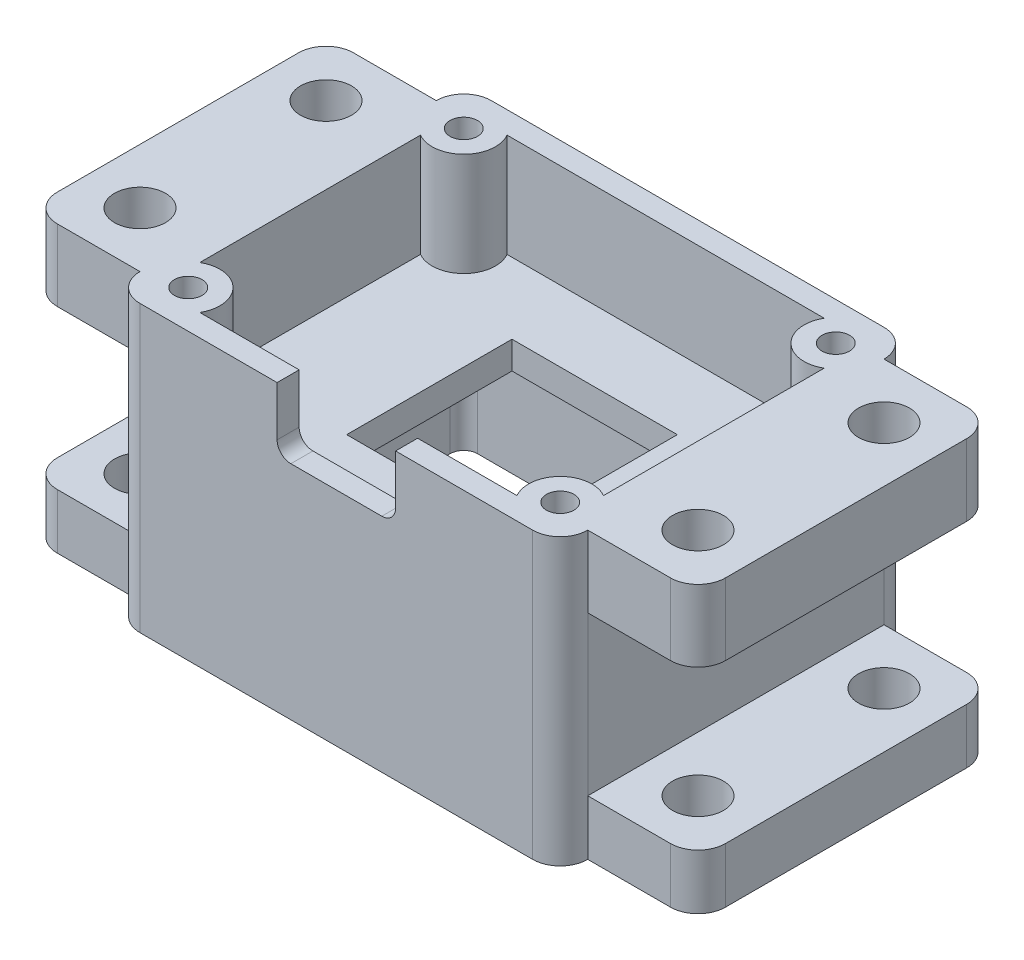
from build123d import *

# Parameters (mm, degrees)
SKETCH_1_W             = 32.5
SKETCH_1_H             = 25.5
SKETCH_1_W_2           = 28.5
SKETCH_1_H_2           = 21.5
EXTRUDE_1_DEPTH        = 13.2
SKETCH_2_W             = 28.5
SKETCH_2_H             = 21.5
SKETCH_2_W_2           = 12
SKETCH_2_H_2           = 12
EXTRUDE_2_DEPTH        = 2
EXTRUDE_3_DEPTH        = 6.3
EXTRUDE_4_REACH        = 30.406
SKETCH_6_R             = 2.7
SKETCH_7_R             = 1
CUT_EXTRUDE_3_DEPTH    = 5.5
SKETCH_10_W            = 15.8
SKETCH_10_H            = 15.8
SKETCH_10_W_2          = 14.2
SKETCH_10_H_2          = 14.2
EXTRUDE_5_DEPTH        = 0.8
CUT_EXTRUDE_5_DEPTH    = 3
FILLET_6_R             = 0.5
FILLET_1_R             = 2
FILLET_2_R             = 1
SKETCH_12_W            = 21.5
SKETCH_12_H            = 5
EXTRUDE_7_DEPTH        = 8
SKETCH_13_R            = 1.85
CUT_EXTRUDE_7_DEPTH    = 8
FILLET_7_R             = 2
SKETCH_15_W            = 21.5
SKETCH_15_H            = 5
EXTRUDE_8_DEPTH        = 8
CUT_EXTRUDE_START      = 26
SKETCH_13_3_R          = 1.85
CUT_EXTRUDE_8_DEPTH    = 26
FILLET_8_R             = 2
FILLET_7_OF_MIRROR_1_R = 2
FILLET_8_OF_MIRROR_1_R = 2
MOVE_START             = 13.2
MOVE_FACE_2_DEPTH      = 6.3
MOVE_FACE_3_BY         = 0.3
MOVE_FACE_3_2_BY       = 0.3
MOVE_FACE_3_3_BY       = 0.3
MOVE_FACE_3_4_BY       = 0.3
MOVE_FACE_3_5_BY       = 0.3
MOVE_FACE_3_6_BY       = 0.3
MOVE_FACE_3_7_BY       = 0.3
MOVE_FACE_3_8_BY       = 0.3
MOVE_FACE_3_9_BY       = 0.3
MOVE_FACE_3_10_BY      = 0.3
MOVE_FACE_3_11_BY      = 0.3
MOVE_FACE_3_12_BY      = 0.3
CUT_EXTRUDE_9_DEPTH    = 1
CUT_EXTRUDE_10_DEPTH   = 1
CUT_EXTRUDE_11_DEPTH   = 1
CUT_EXTRUDE_12_DEPTH   = 1
EXTRUDE_START          = 1.2
SKETCH_23_R            = 1.85
SKETCH_23_R_2          = 1
EXTRUDE_9_DEPTH        = 1.2
SKETCH_25_W            = 2
SKETCH_25_H            = 4.682452006
CUT_EXTRUDE_13_DEPTH   = 8.6
EXTRUDE_11_OUTLINE_W   = 8.6
EXTRUDE_11_OUTLINE_H   = 1.6
EXTRUDE_11_DEPTH       = 1.6
FILLET_9_R             = 1


# Read off the part's stored shape, not the designer's step: 移动面2, 凸台-拉伸11
with BuildPart() as part:
    # 草图1 → 凸台-拉伸1 (new body)
    with BuildSketch(Plane(origin=(0, 0, 0), x_dir=(1, 0, 0), z_dir=(0, 1, 0))):
        Rectangle(SKETCH_1_W, SKETCH_1_H)
        Rectangle(SKETCH_1_W_2, SKETCH_1_H_2, mode=Mode.SUBTRACT)
    extrude(amount=EXTRUDE_1_DEPTH)

    # 草图2 → 凸台-拉伸2 (add)
    with BuildSketch(Plane(origin=(0, 13.2, 0), x_dir=(1, 0, 0), z_dir=(0, 1, 0))):
        Rectangle(SKETCH_2_W, SKETCH_2_H)
        Rectangle(SKETCH_2_W_2, SKETCH_2_H_2, mode=Mode.SUBTRACT)
    extrude(amount=-EXTRUDE_2_DEPTH)

    # 草图3 → 凸台-拉伸3 (add)
    with BuildSketch(Plane(origin=(0, 13.2, 0), x_dir=(1, 0, 0), z_dir=(0, 1, 0))):
        Polygon((-16.25, -12.75), (-16.25, 12.75), (16.25, 12.75), (16.25, -0.040360215), (16.25, -12.75), align=None)
        Polygon((14.25, 0.013681835), (14.25, 10.75), (-14.25, 10.75), (-14.25, -10.75), (14.25, -10.75), align=None, mode=Mode.SUBTRACT)
    extrude(amount=EXTRUDE_3_DEPTH)

    # 草图6 → 凸台-拉伸4 (add, up to next)
    with BuildSketch(Plane(origin=(0, 19.5, 0), x_dir=(1, 0, 0), z_dir=(0, 1, 0)), mode=Mode.PRIVATE) as extrude_4_sk1:
        with Locations((13.5, 10)):
            Circle(SKETCH_6_R)
    extrude_4_tool1 = extrude(extrude_4_sk1.sketch, amount=-EXTRUDE_4_REACH, mode=Mode.PRIVATE) - part.part
    # 草图6 → 凸台-拉伸4 (add, up to next)
    with BuildSketch(Plane(origin=(0, 19.5, 0), x_dir=(1, 0, 0), z_dir=(0, 1, 0)), mode=Mode.PRIVATE) as extrude_4_sk2:
        with Locations((13.5, -10)):
            Circle(SKETCH_6_R)
    extrude_4_tool2 = extrude(extrude_4_sk2.sketch, amount=-EXTRUDE_4_REACH, mode=Mode.PRIVATE) - part.part
    # 草图6 → 凸台-拉伸4 (add, up to next)
    with BuildSketch(Plane(origin=(0, 19.5, 0), x_dir=(1, 0, 0), z_dir=(0, 1, 0)), mode=Mode.PRIVATE) as extrude_4_sk3:
        with Locations((-13.5, -10)):
            Circle(SKETCH_6_R)
    extrude_4_tool3 = extrude(extrude_4_sk3.sketch, amount=-EXTRUDE_4_REACH, mode=Mode.PRIVATE) - part.part
    # 草图6 → 凸台-拉伸4 (add, up to next)
    with BuildSketch(Plane(origin=(0, 19.5, 0), x_dir=(1, 0, 0), z_dir=(0, 1, 0)), mode=Mode.PRIVATE) as extrude_4_sk4:
        with Locations((-13.5, 10)):
            Circle(SKETCH_6_R)
    extrude_4_tool4 = extrude(extrude_4_sk4.sketch, amount=-EXTRUDE_4_REACH, mode=Mode.PRIVATE) - part.part
    add(extrude_4_tool1.solids().sort_by_distance((13.5, 19.5, -10))[0])
    add(extrude_4_tool2.solids().sort_by_distance((13.5, 19.5, 10))[0])
    add(extrude_4_tool3.solids().sort_by_distance((-13.5, 19.5, 10))[0])
    add(extrude_4_tool4.solids().sort_by_distance((-13.5, 19.5, -10))[0])

    # 草图7 → 切除-拉伸3 (cut)
    with BuildSketch(Plane(origin=(0, 19.5, 0), x_dir=(1, 0, 0), z_dir=(0, 1, 0))):
        with Locations(Location((13.5, 10, 0), (0, 0, 270))):
            Circle(SKETCH_7_R)
        with Locations(Location((13.5, -10, 0), (0, 0, 90))):
            Circle(SKETCH_7_R)
        with Locations(Location((-13.5, -10, 0), (0, 0, 270))):
            Circle(SKETCH_7_R)
        with Locations(Location((-13.5, 10, 0), (0, 0, 90))):
            Circle(SKETCH_7_R)
    extrude(amount=-CUT_EXTRUDE_3_DEPTH, mode=Mode.SUBTRACT)

    # 草图10 → 凸台-拉伸5 (add)
    with BuildSketch(Plane.XZ.offset(-11.2)):
        Rectangle(SKETCH_10_W, SKETCH_10_H)
        Rectangle(SKETCH_10_W_2, SKETCH_10_H_2, mode=Mode.SUBTRACT)
    extrude(amount=EXTRUDE_5_DEPTH)

    # 草图11 → 切除-拉伸5 (cut)
    with BuildSketch(Plane.XY.offset(12.75)):
        Polygon((-4, 17.65), (4, 17.65), (4, 15.8), (3, 14.8), (-3, 14.8), (-4, 15.8), align=None)
    extrude(amount=-CUT_EXTRUDE_5_DEPTH, mode=Mode.SUBTRACT)

    # 圆角6
    fillet_6_edges = [part.edges().sort_by_distance(p)[0] for p in [
        (4, 17.65, 11.75),
        (4, 15.8, 11.75),
        (3, 14.8, 11.75),
        (-3, 14.8, 11.75),
        (-4, 15.8, 11.75),
        (-4, 17.65, 11.75),
    ]]
    fillet(fillet_6_edges, radius=FILLET_6_R)

    # 圆角1
    fillet_1_edges = [part.edges().sort_by_distance(p)[0] for p in [
        (16.25, 9.75, 12.75),
        (-16.25, 9.75, 12.75),
        (-16.25, 9.75, -12.75),
        (16.25, 9.75, -12.75),
    ]]
    fillet(fillet_1_edges, radius=FILLET_1_R)

    # 圆角2
    fillet_2_edges = [part.edges().sort_by_distance(p)[0] for p in [
        (-14.25, 5.6, 10.75),
        (14.25, 5.6, 10.75),
        (-14.25, 5.6, -10.75),
        (14.25, 5.6, -10.75),
    ]]
    fillet(fillet_2_edges, radius=FILLET_2_R)

    # 草图12 → 凸台-拉伸7 (add)
    with BuildSketch(Plane(origin=(16.25, 0, 0), x_dir=(0, 0, -1), z_dir=(1, 0, 0))):
        with Locations((0, 2.5)):
            Rectangle(SKETCH_12_W, SKETCH_12_H)
    extrude_7 = extrude(amount=EXTRUDE_7_DEPTH)

    # 草图13 → 切除-拉伸7 (cut)
    with BuildSketch(Plane(origin=(0, 5, 0), x_dir=(1, 0, 0), z_dir=(0, 1, 0))):
        with Locations(Location((20.25, 6.75, 0), (0, 0, 270))):
            Circle(SKETCH_13_R)
        with Locations(Location((20.25, -6.75, 0), (0, 0, 270))):
            Circle(SKETCH_13_R)
    cut_extrude_7 = extrude(amount=-CUT_EXTRUDE_7_DEPTH, mode=Mode.SUBTRACT)

    # 圆角7
    fillet_7_edges = [part.edges().sort_by_distance(p)[0] for p in [
        (24.25, 2.5, -10.75),
        (24.25, 2.5, 10.75),
    ]]
    fillet(fillet_7_edges, radius=FILLET_7_R)

    # 草图15 → 凸台-拉伸8 (add)
    with BuildSketch(Plane(origin=(16.25, 0, 0), x_dir=(0, 0, -1), z_dir=(1, 0, 0))):
        with Locations((0, 17)):
            Rectangle(SKETCH_15_W, SKETCH_15_H)
    extrude_8 = extrude(amount=EXTRUDE_8_DEPTH)

    # 草图13<3> → 切除-拉伸8 (cut)
    with BuildSketch(Plane(origin=(0, 5, 0), x_dir=(1, 0, 0), z_dir=(0, 1, 0)).offset(CUT_EXTRUDE_START)):
        with Locations(Location((20.25, 6.75, 0), (0, 0, 270))):
            Circle(SKETCH_13_3_R)
        with Locations(Location((20.25, -6.75, 0), (0, 0, 270))):
            Circle(SKETCH_13_3_R)
    cut_extrude_8 = extrude(amount=-CUT_EXTRUDE_8_DEPTH, mode=Mode.SUBTRACT)

    # 圆角8
    fillet_8_edges = [part.edges().sort_by_distance(p)[0] for p in [
        (24.25, 17, -10.75),
        (24.25, 17, 10.75),
    ]]
    fillet(fillet_8_edges, radius=FILLET_8_R)

    # 镜向1: 凸台-拉伸7, 切除-拉伸7, 凸台-拉伸8, 切除-拉伸8 across plane
    add(extrude_7.mirror(Plane(origin=(0, 0, 0), x_dir=(0, 0, 1), z_dir=(1, 0, 0))))
    add(cut_extrude_7.mirror(Plane(origin=(0, 0, 0), x_dir=(0, 0, 1), z_dir=(1, 0, 0))), mode=Mode.SUBTRACT)
    add(extrude_8.mirror(Plane(origin=(0, 0, 0), x_dir=(0, 0, 1), z_dir=(1, 0, 0))))
    add(cut_extrude_8.mirror(Plane(origin=(0, 0, 0), x_dir=(0, 0, 1), z_dir=(1, 0, 0))), mode=Mode.SUBTRACT)

    # 圆角7 of 镜向1
    fillet_7_of_mirror_1_edges = [part.edges().sort_by_distance(p)[0] for p in [
        (-24.25, 2.5, -10.75),
        (-24.25, 2.5, 10.75),
    ]]
    fillet(fillet_7_of_mirror_1_edges, radius=FILLET_7_OF_MIRROR_1_R)

    # 圆角8 of 镜向1
    fillet_8_of_mirror_1_edges = [part.edges().sort_by_distance(p)[0] for p in [
        (-24.25, 17, -10.75),
        (-24.25, 17, 10.75),
    ]]
    fillet(fillet_8_of_mirror_1_edges, radius=FILLET_8_OF_MIRROR_1_R)

    # Move Face 2 outline → Move Face 2 (cut)
    with BuildSketch(Plane(origin=(0, 0, 0), x_dir=(1, 0, 0), z_dir=(0, 1, 0)).offset(MOVE_START)):
        with BuildLine():
            ThreePointArc((11.508141571, -11.15), (11.873654403, -8.373654403), (14.65, -8.008141571))
            Line((14.65, -8.008141571), (14.65, 8.008141571))
            ThreePointArc((14.65, 8.008141571), (11.873654403, 8.373654403), (11.508141571, 11.15))
            Line((11.508141571, 11.15), (-11.508141571, 11.15))
            ThreePointArc((-11.508141571, 11.15), (-11.873654403, 8.373654403), (-14.65, 8.008141571))
            Line((-14.65, 8.008141571), (-14.65, -8.008141571))
            ThreePointArc((-14.65, -8.008141571), (-11.873654403, -8.373654403), (-11.508141571, -11.15))
            Line((-11.508141571, -11.15), (11.508141571, -11.15))
        make_face()
        with BuildLine():
            Line((10.90625753, -10.75), (-10.90625753, -10.75))
            ThreePointArc((-10.90625753, -10.75), (-11.590811691, -8.090811691), (-14.25, -7.40625753))
            Line((-14.25, -7.40625753), (-14.25, 7.40625753))
            ThreePointArc((-14.25, 7.40625753), (-11.590811691, 8.090811691), (-10.90625753, 10.75))
            Line((-10.90625753, 10.75), (10.90625753, 10.75))
            ThreePointArc((10.90625753, 10.75), (11.590811691, 8.090811691), (14.25, 7.40625753))
            Line((14.25, 7.40625753), (14.25, -7.40625753))
            ThreePointArc((14.25, -7.40625753), (11.590811691, -8.090811691), (10.90625753, -10.75))
        make_face(mode=Mode.SUBTRACT)
    extrude(amount=MOVE_FACE_2_DEPTH, mode=Mode.SUBTRACT)

    # Move Face 3: a curved face moved inward by 0.3
    add(Solid.thicken(part.faces().sort_by_distance((2.984234935, 14.838060234, 11.95))[0], -MOVE_FACE_3_BY), mode=Mode.SUBTRACT)

    # Move Face 3 2: a face moved inward by 0.3
    extrude(part.faces().sort_by_distance((3.5, 15.3, 11.95))[0], amount=MOVE_FACE_3_2_BY, dir=(0.707106781, -0.707106781, 0), mode=Mode.SUBTRACT)

    # Move Face 3 3: a curved face moved inward by 0.3
    add(Solid.thicken(part.faces().sort_by_distance((3.961939766, 15.815765065, 11.95))[0], -MOVE_FACE_3_3_BY), mode=Mode.SUBTRACT)

    # Move Face 3 4: a curved face moved inward by 0.3
    add(Solid.thicken(part.faces().sort_by_distance((3.853553391, 17.503553391, 11.95))[0], -MOVE_FACE_3_4_BY), mode=Mode.SUBTRACT)

    # Move Face 3 5: a face moved inward by 0.3
    extrude(part.faces().sort_by_distance((4, 16.578553391, 11.95))[0], amount=MOVE_FACE_3_5_BY, dir=(1, 0, 0), mode=Mode.SUBTRACT)

    # Move Face 3 6: a face moved inward by 0.3
    extrude(part.faces().sort_by_distance((0, 17.65, 11.95))[0], amount=MOVE_FACE_3_6_BY, dir=(0, 1, 0), mode=Mode.SUBTRACT)

    # Move Face 3 7: a curved face moved inward by 0.3
    add(Solid.thicken(part.faces().sort_by_distance((-3.853553391, 17.503553391, 11.95))[0], -MOVE_FACE_3_7_BY), mode=Mode.SUBTRACT)

    # Move Face 3 8: a face moved inward by 0.3
    extrude(part.faces().sort_by_distance((-4, 16.578553391, 11.95))[0], amount=MOVE_FACE_3_8_BY, dir=(-1, 0, 0), mode=Mode.SUBTRACT)

    # Move Face 3 9: a curved face moved inward by 0.3
    add(Solid.thicken(part.faces().sort_by_distance((-3.961939766, 15.815765065, 11.95))[0], -MOVE_FACE_3_9_BY), mode=Mode.SUBTRACT)

    # Move Face 3 10: a face moved inward by 0.3
    extrude(part.faces().sort_by_distance((-3.5, 15.3, 11.95))[0], amount=MOVE_FACE_3_10_BY, dir=(-0.707106781, -0.707106781, 0), mode=Mode.SUBTRACT)

    # Move Face 3 11: a curved face moved inward by 0.3
    add(Solid.thicken(part.faces().sort_by_distance((-2.984234935, 14.838060234, 11.95))[0], -MOVE_FACE_3_11_BY), mode=Mode.SUBTRACT)

    # Move Face 3 12: a face moved inward by 0.3
    extrude(part.faces().sort_by_distance((0, 14.8, 11.95))[0], amount=MOVE_FACE_3_12_BY, dir=(0, -1, 0), mode=Mode.SUBTRACT)

    # 草图17 → 切除-拉伸9 (cut)
    with BuildSketch(Plane(origin=(0, 5, 0), x_dir=(1, 0, 0), z_dir=(0, 1, 0))):
        with BuildLine():
            Line((16.25, -10.75), (22.25, -10.75))
            ThreePointArc((22.25, -10.75), (23.664213562, -10.164213562), (24.25, -8.75))
            Line((24.25, -8.75), (24.25, 8.75))
            ThreePointArc((24.25, 8.75), (23.664213562, 10.164213562), (22.25, 10.75))
            Line((22.25, 10.75), (16.25, 10.75))
            Line((16.25, 10.75), (16.25, -10.75))
        make_face()
    extrude(amount=-CUT_EXTRUDE_9_DEPTH, mode=Mode.SUBTRACT)

    # 草图18 → 切除-拉伸10 (cut)
    with BuildSketch(Plane.XZ.offset(-14.5)):
        with BuildLine():
            Line((24.25, -8.75), (24.25, 8.75))
            ThreePointArc((24.25, 8.75), (23.664213562, 10.164213562), (22.25, 10.75))
            Line((22.25, 10.75), (16.25, 10.75))
            Line((16.25, 10.75), (16.25, -10.75))
            Line((16.25, -10.75), (22.25, -10.75))
            ThreePointArc((22.25, -10.75), (23.664213562, -10.164213562), (24.25, -8.75))
        make_face()
    extrude(amount=-CUT_EXTRUDE_10_DEPTH, mode=Mode.SUBTRACT)

    # 草图19 → 切除-拉伸11 (cut)
    with BuildSketch(Plane.XZ.offset(-14.5)):
        with BuildLine():
            Line((-16.25, 10.75), (-22.25, 10.75))
            ThreePointArc((-22.25, 10.75), (-23.664213562, 10.164213562), (-24.25, 8.75))
            Line((-24.25, 8.75), (-24.25, -8.75))
            ThreePointArc((-24.25, -8.75), (-23.664213562, -10.164213562), (-22.25, -10.75))
            Line((-22.25, -10.75), (-16.25, -10.75))
            Line((-16.25, -10.75), (-16.25, 10.75))
        make_face()
    extrude(amount=-CUT_EXTRUDE_11_DEPTH, mode=Mode.SUBTRACT)

    # 草图20 → 切除-拉伸12 (cut)
    with BuildSketch(Plane(origin=(0, 5, 0), x_dir=(1, 0, 0), z_dir=(0, 1, 0))):
        with BuildLine():
            Line((-24.25, 8.75), (-24.25, -8.75))
            ThreePointArc((-24.25, -8.75), (-23.664213562, -10.164213562), (-22.25, -10.75))
            Line((-22.25, -10.75), (-16.25, -10.75))
            Line((-16.25, -10.75), (-16.25, 10.75))
            Line((-16.25, 10.75), (-22.25, 10.75))
            ThreePointArc((-22.25, 10.75), (-23.664213562, 10.164213562), (-24.25, 8.75))
        make_face()
    extrude(amount=-CUT_EXTRUDE_12_DEPTH, mode=Mode.SUBTRACT)

    # 草图23 → 凸台-拉伸9 (add)
    with BuildSketch(Plane(origin=(0, 19.5, 0), x_dir=(1, 0, 0), z_dir=(0, 1, 0)).offset(EXTRUDE_START)):
        with BuildLine():
            Line((-24.25, 8.75), (-24.25, -8.75))
            ThreePointArc((-24.25, -8.75), (-23.664213562, -10.164213562), (-22.25, -10.75))
            Line((-22.25, -10.75), (-16.25, -10.75))
            ThreePointArc((-16.25, -10.75), (-15.664213562, -12.164213562), (-14.25, -12.75))
            Line((-14.25, -12.75), (14.25, -12.75))
            ThreePointArc((14.25, -12.75), (15.664213562, -12.164213562), (16.25, -10.75))
            Line((16.25, -10.75), (22.25, -10.75))
            ThreePointArc((22.25, -10.75), (23.664213562, -10.164213562), (24.25, -8.75))
            Line((24.25, -8.75), (24.25, 8.75))
            ThreePointArc((24.25, 8.75), (23.664213562, 10.164213562), (22.25, 10.75))
            Line((22.25, 10.75), (16.25, 10.75))
            ThreePointArc((16.25, 10.75), (15.664213562, 12.164213562), (14.25, 12.75))
            Line((14.25, 12.75), (-14.25, 12.75))
            ThreePointArc((-14.25, 12.75), (-15.664213562, 12.164213562), (-16.25, 10.75))
            Line((-16.25, 10.75), (-22.25, 10.75))
            ThreePointArc((-22.25, 10.75), (-23.664213562, 10.164213562), (-24.25, 8.75))
        make_face()
        with Locations(Location((20.25, -6.75, 0), (0, 0, 90))):
            Circle(SKETCH_23_R, mode=Mode.SUBTRACT)
        with Locations(Location((20.25, 6.75, 0), (0, 0, 90))):
            Circle(SKETCH_23_R, mode=Mode.SUBTRACT)
        with Locations(Location((-20.25, -6.75, 0), (0, 0, 270))):
            Circle(SKETCH_23_R, mode=Mode.SUBTRACT)
        with Locations(Location((-20.25, 6.75, 0), (0, 0, 270))):
            Circle(SKETCH_23_R, mode=Mode.SUBTRACT)
        with Locations(Location((13.5, -10, 0), (0, 0, 270))):
            Circle(SKETCH_23_R_2, mode=Mode.SUBTRACT)
        with Locations(Location((13.5, 10, 0), (0, 0, 270))):
            Circle(SKETCH_23_R_2, mode=Mode.SUBTRACT)
        with Locations(Location((-13.5, -10, 0), (0, 0, 270))):
            Circle(SKETCH_23_R_2, mode=Mode.SUBTRACT)
        with Locations(Location((-13.5, 10, 0), (0, 0, 270))):
            Circle(SKETCH_23_R_2, mode=Mode.SUBTRACT)
        with BuildLine():
            Line((14.65, -8.008141571), (14.65, 8.008141571))
            ThreePointArc((14.65, 8.008141571), (11.873654403, 8.373654403), (11.508141571, 11.15))
            Line((11.508141571, 11.15), (-11.508141571, 11.15))
            ThreePointArc((-11.508141571, 11.15), (-11.873654403, 8.373654403), (-14.65, 8.008141571))
            Line((-14.65, 8.008141571), (-14.65, -8.008141571))
            ThreePointArc((-14.65, -8.008141571), (-11.873654403, -8.373654403), (-11.508141571, -11.15))
            Line((-11.508141571, -11.15), (11.508141571, -11.15))
            ThreePointArc((11.508141571, -11.15), (11.873654403, -8.373654403), (14.65, -8.008141571))
        make_face(mode=Mode.SUBTRACT)
    extrude(amount=-EXTRUDE_9_DEPTH)

    # 草图25 → 切除-拉伸13 (cut)
    with BuildSketch(Plane(origin=(-4.3, 0, 0), x_dir=(0, 0, -1), z_dir=(1, 0, 0))):
        with Locations((-11.75, 18.358773997)):
            Rectangle(SKETCH_25_W, SKETCH_25_H)
    extrude(amount=CUT_EXTRUDE_13_DEPTH, mode=Mode.SUBTRACT)

    # 凸台-拉伸11 outline → 凸台-拉伸11 (add)
    with BuildSketch(Plane(origin=(0, 14.5, 0), x_dir=(1, 0, 0), z_dir=(0, 1, 0))):
        with Locations((0, -11.95)):
            Rectangle(EXTRUDE_11_OUTLINE_W, EXTRUDE_11_OUTLINE_H)
    extrude(amount=EXTRUDE_11_DEPTH)

    # 圆角9
    fillet_9_edges = [part.edges().sort_by_distance(p)[0] for p in [
        (-4.3, 16.1, 11.95),
        (4.3, 16.1, 11.95),
    ]]
    fillet(fillet_9_edges, radius=FILLET_9_R)


solid = part.part
